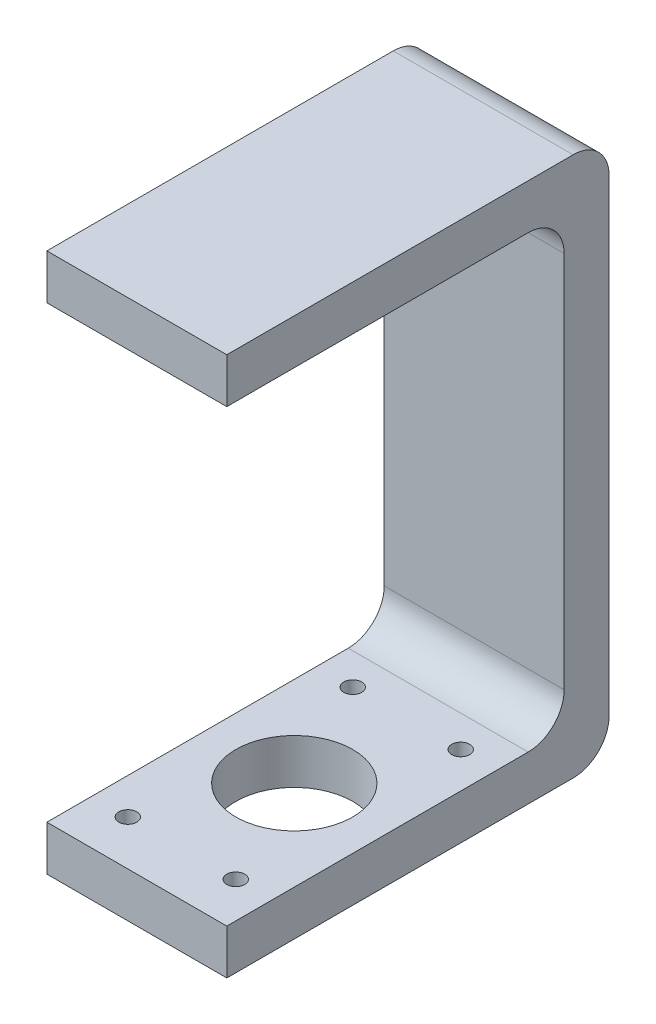
from build123d import *

# Parameters (mm, degrees)
EXTRUDE_1_DEPTH     = 40
CUT_EXTRUDE_1_REACH = 154.398
SKETCH_5_R          = 13
SKETCH_7_R          = 2
CUT_EXTRUDE_2_DEPTH = 10


with BuildPart() as part:
    # 草图1 → 凸台-拉伸1 (new body)
    with BuildSketch(Plane(origin=(0, 0, 0), x_dir=(0, 0, -1), z_dir=(1, 0, 0))):
        with BuildLine():
            Line((0, 0), (77, 0))
            ThreePointArc((77, 0), (82.656854249, 2.343145751), (85, 8))
            Line((85, 8), (85, 112))
            ThreePointArc((85, 112), (82.656854249, 117.656854249), (77, 120))
            Line((77, 120), (0, 120))
            Line((0, 120), (0, 110))
            Line((0, 110), (67, 110))
            ThreePointArc((67, 110), (72.656854249, 107.656854249), (75, 102))
            Line((75, 102), (75, 18))
            ThreePointArc((75, 18), (72.656854249, 12.343145751), (67, 10))
            Line((67, 10), (0, 10))
            Line((0, 10), (0, 0))
        make_face()
    extrude(amount=EXTRUDE_1_DEPTH)

    # 草图5 → 切除-拉伸1 (cut, up to next)
    with BuildSketch(Plane.XZ, mode=Mode.PRIVATE) as cut_extrude_1_sk1:
        with Locations((20, -35)):
            Circle(SKETCH_5_R)
    cut_extrude_1_tool1 = extrude(cut_extrude_1_sk1.sketch, amount=-CUT_EXTRUDE_1_REACH, mode=Mode.PRIVATE) & part.part
    add(cut_extrude_1_tool1.solids().sort_by_distance((20, 0, -35))[0], mode=Mode.SUBTRACT)

    # 草图7 → 切除-拉伸2 (cut)
    with BuildSketch(Plane(origin=(0, 10, 0), x_dir=(1, 0, 0), z_dir=(0, 1, 0))):
        with Locations((32, 10)):
            Circle(SKETCH_7_R)
        with Locations((8, 10)):
            Circle(SKETCH_7_R)
        with Locations((8, 60)):
            Circle(SKETCH_7_R)
        with Locations((32, 60)):
            Circle(SKETCH_7_R)
    extrude(amount=-CUT_EXTRUDE_2_DEPTH, mode=Mode.SUBTRACT)


solid = part.part
